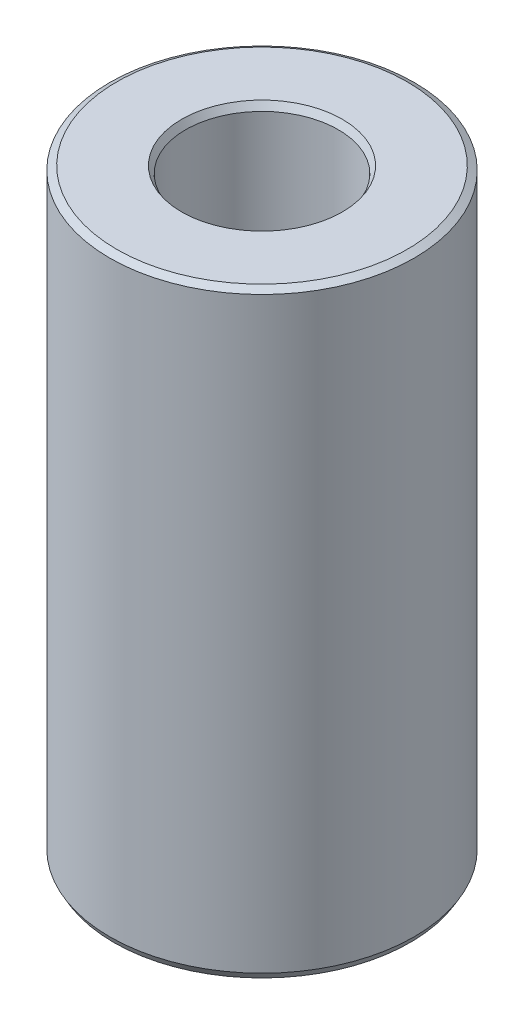
from build123d import *
from OCP.BRepFilletAPI import BRepFilletAPI_MakeChamfer

# Parameters (mm, degrees)
SKETCH1_R           = 12.5
BOSS_EXTRUDE1_DEPTH = 49.18200734
SKETCH2_R           = 6.267267748
CUT_EXTRUDE1_DEPTH  = 53.26250899
CHAMFER1_SIZE       = 0.331467534
CHAMFER1_SIZE2      = 0.574118611


with BuildPart() as part:
    # Sketch1 → Boss-Extrude1 (new body)
    with BuildSketch(Plane(origin=(0, 0, 0), x_dir=(1, 0, 0), z_dir=(0, 1, 0))):
        Circle(SKETCH1_R)
    extrude(amount=BOSS_EXTRUDE1_DEPTH)

    # Sketch2 → Cut-Extrude1 (cut, through all)
    with BuildSketch(Plane(origin=(0, 0, 0), x_dir=(1, 0, 0), z_dir=(0, 1, 0))):
        Circle(SKETCH2_R)
    extrude(amount=CUT_EXTRUDE1_DEPTH, mode=Mode.SUBTRACT)

    # Chamfer1: one chamfer whose edges measure the first distance from different faces: ONE call of the kernel's chamfer builder (chamfer() names one face for all edges)
    chamfer1_edges_1 = [part.edges().sort_by_distance(p)[0] for p in [
        (-6.267267748, 49.18200734, 0),
    ]]
    chamfer1_side_1 = [part.faces().sort_by_distance(p)[0] for p in [
        (-12.146446609, 49.18200734, 0),
    ]]
    chamfer1_edges_2 = [part.edges().sort_by_distance(p)[0] for p in [
        (-6.267267748, 0, 0),
    ]]
    chamfer1_side_2 = [part.faces().sort_by_distance(p)[0] for p in [
        (-6.267267748, 24.59100367, 0),
    ]]
    chamfer1_edges_3 = [part.edges().sort_by_distance(p)[0] for p in [
        (-12.5, 0, 0),
    ]]
    chamfer1_side_3 = [part.faces().sort_by_distance(p)[0] for p in [
        (-12.146446609, 0, 0),
    ]]
    chamfer1_edges_4 = [part.edges().sort_by_distance(p)[0] for p in [
        (-12.5, 49.18200734, 0),
    ]]
    chamfer1_side_4 = [part.faces().sort_by_distance(p)[0] for p in [
        (-12.5, 24.59100367, 0),
    ]]
    chamfer1 = BRepFilletAPI_MakeChamfer(part.part.solid().wrapped)
    for e in chamfer1_edges_1:
        chamfer1.Add(CHAMFER1_SIZE, CHAMFER1_SIZE2, e.wrapped, chamfer1_side_1[0].wrapped)  # the first distance lies on this face
    for e in chamfer1_edges_2:
        chamfer1.Add(CHAMFER1_SIZE, CHAMFER1_SIZE2, e.wrapped, chamfer1_side_2[0].wrapped)  # the first distance lies on this face
    for e in chamfer1_edges_3:
        chamfer1.Add(CHAMFER1_SIZE, CHAMFER1_SIZE2, e.wrapped, chamfer1_side_3[0].wrapped)  # the first distance lies on this face
    for e in chamfer1_edges_4:
        chamfer1.Add(CHAMFER1_SIZE, CHAMFER1_SIZE2, e.wrapped, chamfer1_side_4[0].wrapped)  # the first distance lies on this face
    add(Compound.cast(chamfer1.Shape()), mode=Mode.REPLACE)


solid = part.part
